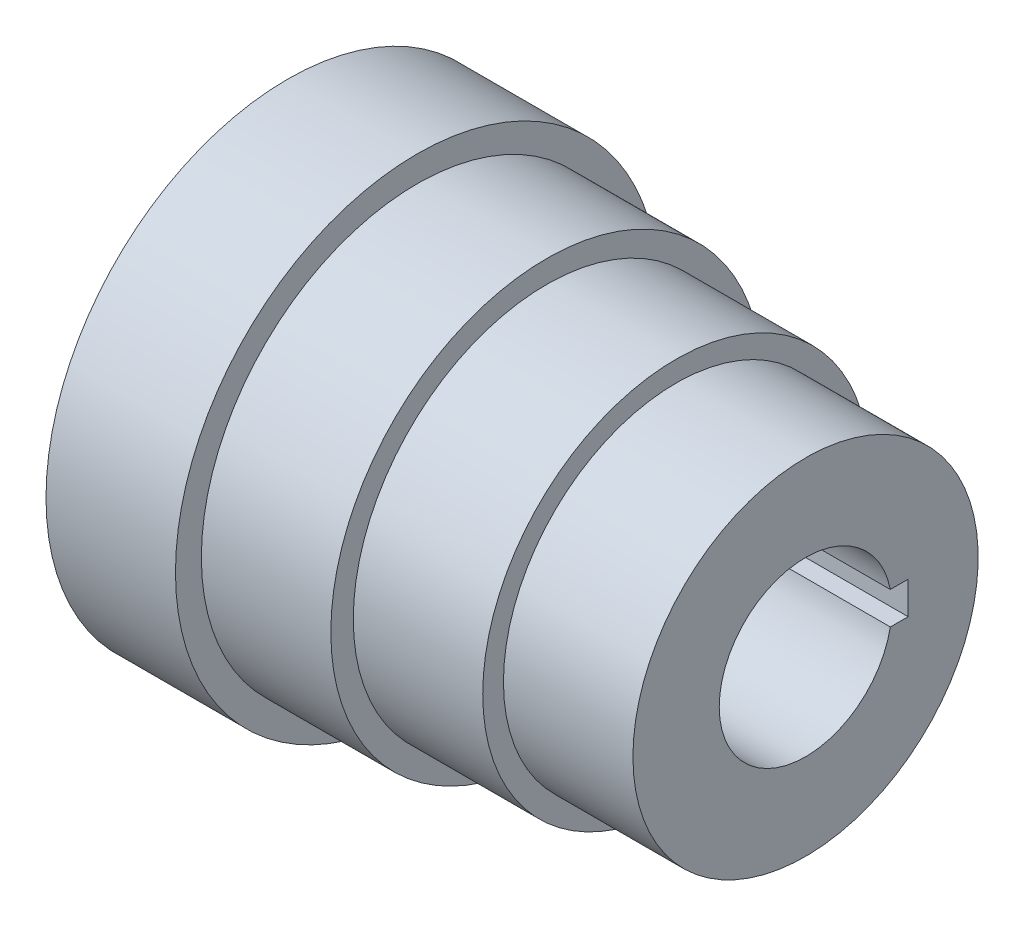
from build123d import *

# Parameters (mm, degrees)
SKETCH3_W          = 4.7752
SKETCH3_H          = 4.7752
CUT_EXTRUDE1_DEPTH = 92.298779839


with BuildPart() as part:
    # Sketch1 → Revolve1 (revolve)
    with BuildSketch(Plane.XY):
        with BuildLine():
            Line((-38.1, 35.56), (-19.05, 35.56))
            Line((-19.05, 35.56), (-19.05, 31.75))
            Line((-19.05, 31.75), (0, 31.75))
            Line((0, 31.75), (0, 28.448))
            Line((0, 28.448), (19.05, 28.448))
            Line((19.05, 28.448), (19.05, 25.4))
            Line((19.05, 25.4), (38.1, 25.4))
            Line((38.1, 25.4), (38.1, 12.7))
            Line((38.1, 12.7), (-6.61235224, 12.7))
            ThreePointArc((-6.61235224, 12.7), (-10.239814738, 21.587016556), (-19.05, 25.39728992))
            Line((-19.05, 25.39728992), (-19.096408435, 25.4))
            Line((-19.096408435, 25.4), (-38.1, 25.4))
            Line((-38.1, 25.4), (-38.1, 35.56))
        make_face()
    revolve(axis=Axis((-38.1, 0, 0), (1, 0, 0)))

    # Sketch3 → Cut-Extrude1 (cut, through all)
    with BuildSketch(Plane(origin=(38.1, 0, 0), x_dir=(0, 0, -1), z_dir=(1, 0, 0))):
        with Locations((12.7, 0)):
            Rectangle(SKETCH3_W, SKETCH3_H)
    extrude(amount=-CUT_EXTRUDE1_DEPTH, mode=Mode.SUBTRACT)


solid = part.part
